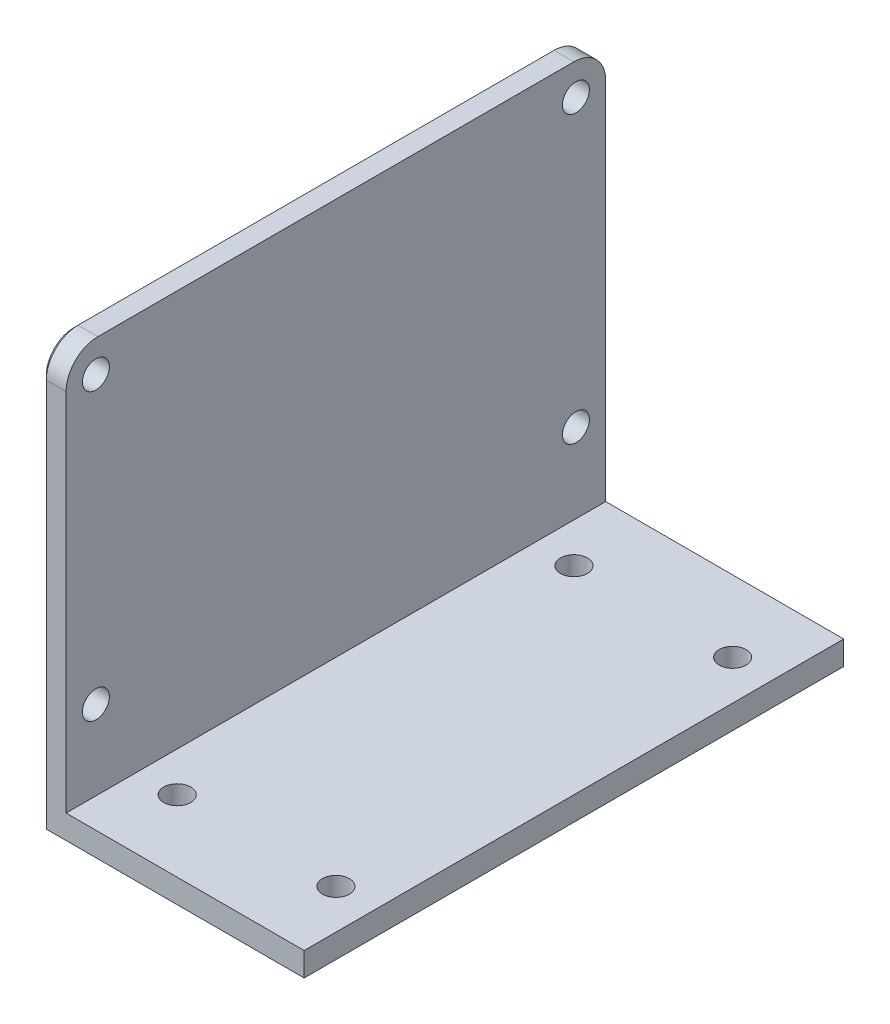
from build123d import *

# Parameters (mm, degrees)
BOSS_EXTRUDE1_DEPTH      = 68
M3_CLEARANCE_HOLE1_D     = 3.4
M3_CLEARANCE_HOLE1_DEPTH = 5
M3_CLEARANCE_HOLE1_TIP   = 1.021463052
M3_CLEARANCE_HOLE2_D     = 3.4
M3_CLEARANCE_HOLE2_DEPTH = 5
M3_CLEARANCE_HOLE2_TIP   = 1.021463052
FILLET1_R                = 4
CHAMFER1_SIZE            = 0.5


with BuildPart() as part:
    # Sketch1 → Boss-Extrude1 (new body)
    with BuildSketch(Plane.XY):
        Polygon((0, 0), (33, 0), (33, 3), (3, 3), (3, 53), (0, 53), align=None)
    extrude(amount=BOSS_EXTRUDE1_DEPTH)

    # M3 Clearance Hole1
    with Locations(Plane(origin=(3, 0, 0), x_dir=(0, 0, -1), z_dir=(1, 0, 0))):
        with Locations((-64.25, 49), (-3.75, 49), (-3.75, 13), (-64.25, 13)):
            Hole(M3_CLEARANCE_HOLE1_D / 2, depth=M3_CLEARANCE_HOLE1_DEPTH)
            with Locations((0, 0, -(M3_CLEARANCE_HOLE1_DEPTH + M3_CLEARANCE_HOLE1_TIP / 2))):  # 118° drill point
                Cone(0, M3_CLEARANCE_HOLE1_D / 2, M3_CLEARANCE_HOLE1_TIP, mode=Mode.SUBTRACT)

    # M3 Clearance Hole2
    with Locations(Plane(origin=(0, 3, 0), x_dir=(1, 0, 0), z_dir=(0, 1, 0))):
        with Locations((28, -59), (8, -59), (8, -9), (28, -9)):
            Hole(M3_CLEARANCE_HOLE2_D / 2, depth=M3_CLEARANCE_HOLE2_DEPTH)
            with Locations((0, 0, -(M3_CLEARANCE_HOLE2_DEPTH + M3_CLEARANCE_HOLE2_TIP / 2))):  # 118° drill point
                Cone(0, M3_CLEARANCE_HOLE2_D / 2, M3_CLEARANCE_HOLE2_TIP, mode=Mode.SUBTRACT)

    # Fillet1
    fillet1_edges = [part.edges().sort_by_distance(p)[0] for p in [
        (1.5, 53, 68),
        (1.5, 53, 0),
    ]]
    fillet(fillet1_edges, radius=FILLET1_R)

    # Chamfer1
    chamfer1_edges = [part.edges().sort_by_distance(p)[0] for p in [
        (0, 24.5, 68),
        (0, 51.828427125, 66.828427125),
        (0, 53, 34),
        (0, 51.828427125, 1.171572875),
        (0, 24.5, 0),
    ]]
    chamfer(chamfer1_edges, length=CHAMFER1_SIZE)


solid = part.part
